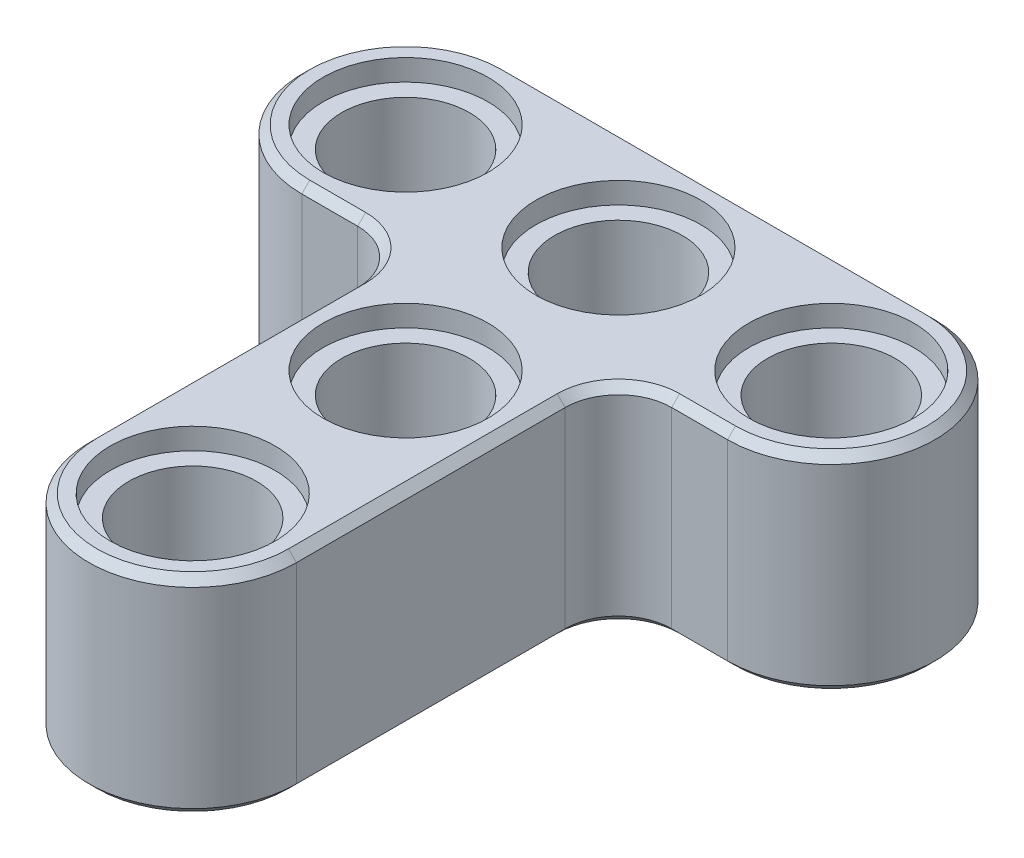
from build123d import *

# Parameters (mm, degrees)
BOSS_EXTRUDE1_DEPTH       = 3.9
SKETCH2_R                 = 2.4
CUT_EXTRUDE1_DEPTH        = 25.463442113
SKETCH3_R                 = 3.1
CUT_EXTRUDE2_DEPTH        = 0.8
LPATTERN1_COUNT           = 2
LPATTERN1_PITCH           = 8
LPATTERN1_COUNT_DIR2      = 2
LPATTERN1_PITCH_DIR2      = 8
LPATTERN1_COPY_1_SKETCH_R = 3.1
LPATTERN1_COPY_1_DEPTH    = 0.8
LPATTERN1_COPY_2_SKETCH_R = 3.1
LPATTERN1_COPY_2_DEPTH    = 0.8
LPATTERN1_COPY_3_SKETCH_R = 3.1
LPATTERN1_COPY_3_DEPTH    = 0.8
LPATTERN2_COUNT           = 3
LPATTERN2_PITCH           = 8
LPATTERN2_COPY_1_SKETCH_R = 3.1
LPATTERN2_COPY_1_DEPTH    = 0.8
LPATTERN2_COPY_2_SKETCH_R = 3.1
LPATTERN2_COPY_2_DEPTH    = 0.8
FILLET1_R                 = 2
CHAMFER1_SIZE             = 0.3


with BuildPart() as part:
    # Sketch1 → Boss-Extrude1 (new, symmetric)
    with BuildSketch(Plane(origin=(0, 0, 0), x_dir=(1, 0, 0), z_dir=(0, 1, 0))):
        with BuildLine():
            Line((-8, -3.9), (8, -3.9))
            ThreePointArc((8, -3.9), (11.9, 0), (8, 3.9))
            Line((8, 3.9), (-8, 3.9))
            ThreePointArc((-8, 3.9), (-11.9, 0), (-8, -3.9))
        make_face()
        with BuildLine():
            Line((-3.9, 0), (-3.9, -16))
            ThreePointArc((-3.9, -16), (0, -19.9), (3.9, -16))
            Line((3.9, -16), (3.9, 0))
            ThreePointArc((3.9, 0), (0, 3.9), (-3.9, 0))
        make_face()
    extrude(amount=BOSS_EXTRUDE1_DEPTH, both=True)

    # Sketch2 → Cut-Extrude1 (cut, through all)
    with BuildSketch(Plane(origin=(0, 3.9, 0), x_dir=(1, 0, 0), z_dir=(0, 1, 0))):
        Circle(SKETCH2_R)
    cut_extrude1 = extrude(amount=-CUT_EXTRUDE1_DEPTH, mode=Mode.SUBTRACT)

    # Sketch3 → Cut-Extrude2 (cut)
    with BuildSketch(Plane(origin=(0, 3.9, 0), x_dir=(1, 0, 0), z_dir=(0, 1, 0))):
        Circle(SKETCH3_R)
    cut_extrude2 = extrude(amount=-CUT_EXTRUDE2_DEPTH, mode=Mode.SUBTRACT)

    # Mirror1: Cut-Extrude2 across plane
    add(cut_extrude2.mirror(Plane.ZX), mode=Mode.SUBTRACT)

    # LPattern1: Cut-Extrude1, Cut-Extrude2 2 × 2
    with Locations(*[Vector(-1, 0, 0) * (i * LPATTERN1_PITCH) + Vector(1, 0, 0) * (j * LPATTERN1_PITCH_DIR2) for i in range(LPATTERN1_COUNT) for j in range(LPATTERN1_COUNT_DIR2) if (i, j) != (0, 0)]):
        add(cut_extrude1, mode=Mode.SUBTRACT)
        add(cut_extrude2, mode=Mode.SUBTRACT)

    # LPattern1 copy 1 sketch → LPattern1 copy 1 (cut)
    with BuildSketch(Plane(origin=(8, -3.9, 0), x_dir=(1, 0, 0), z_dir=(0, -1, 0))):
        Circle(LPATTERN1_COPY_1_SKETCH_R)
    extrude(amount=-LPATTERN1_COPY_1_DEPTH, mode=Mode.SUBTRACT)

    # LPattern1 copy 2 sketch → LPattern1 copy 2 (cut)
    with BuildSketch(Plane(origin=(-8, -3.9, 0), x_dir=(1, 0, 0), z_dir=(0, -1, 0))):
        Circle(LPATTERN1_COPY_2_SKETCH_R)
    extrude(amount=-LPATTERN1_COPY_2_DEPTH, mode=Mode.SUBTRACT)

    # LPattern1 copy 3 sketch → LPattern1 copy 3 (cut)
    with BuildSketch(Plane.XZ.offset(3.9)):
        Circle(LPATTERN1_COPY_3_SKETCH_R)
    extrude(amount=-LPATTERN1_COPY_3_DEPTH, mode=Mode.SUBTRACT)

    # LPattern2: Cut-Extrude1, Cut-Extrude2 ×3
    with Locations(*[(0, 0, i * LPATTERN2_PITCH) for i in range(1, LPATTERN2_COUNT)]):
        add(cut_extrude1, mode=Mode.SUBTRACT)
        add(cut_extrude2, mode=Mode.SUBTRACT)

    # LPattern2 copy 1 sketch → LPattern2 copy 1 (cut)
    with BuildSketch(Plane(origin=(0, -3.9, 8), x_dir=(1, 0, 0), z_dir=(0, -1, 0))):
        Circle(LPATTERN2_COPY_1_SKETCH_R)
    extrude(amount=-LPATTERN2_COPY_1_DEPTH, mode=Mode.SUBTRACT)

    # LPattern2 copy 2 sketch → LPattern2 copy 2 (cut)
    with BuildSketch(Plane(origin=(0, -3.9, 16), x_dir=(1, 0, 0), z_dir=(0, -1, 0))):
        Circle(LPATTERN2_COPY_2_SKETCH_R)
    extrude(amount=-LPATTERN2_COPY_2_DEPTH, mode=Mode.SUBTRACT)

    # Fillet1
    fillet1_edges = [part.edges().sort_by_distance(p)[0] for p in [
        (-3.9, 0, 3.9),
        (3.9, 0, 3.9),
    ]]
    fillet(fillet1_edges, radius=FILLET1_R)

    # Chamfer1
    chamfer1_edges = [part.edges().sort_by_distance(p)[0] for p in [
        (11.9, -3.9, 0),
        (0, -3.9, -3.9),
        (6.95, -3.9, 3.9),
        (-11.9, -3.9, 0),
        (4.485786438, -3.9, 4.485786438),
        (-6.95, -3.9, 3.9),
        (3.9, -3.9, 10.95),
        (-4.485786438, -3.9, 4.485786438),
        (0, -3.9, 19.9),
        (-3.9, -3.9, 10.95),
        (-11.9, 3.9, 0),
        (0, 3.9, -3.9),
        (-6.95, 3.9, 3.9),
        (11.9, 3.9, 0),
        (-4.485786438, 3.9, 4.485786438),
        (6.95, 3.9, 3.9),
        (-3.9, 3.9, 10.95),
        (4.485786438, 3.9, 4.485786438),
        (0, 3.9, 19.9),
        (3.9, 3.9, 10.95),
    ]]
    chamfer(chamfer1_edges, length=CHAMFER1_SIZE)


solid = part.part
